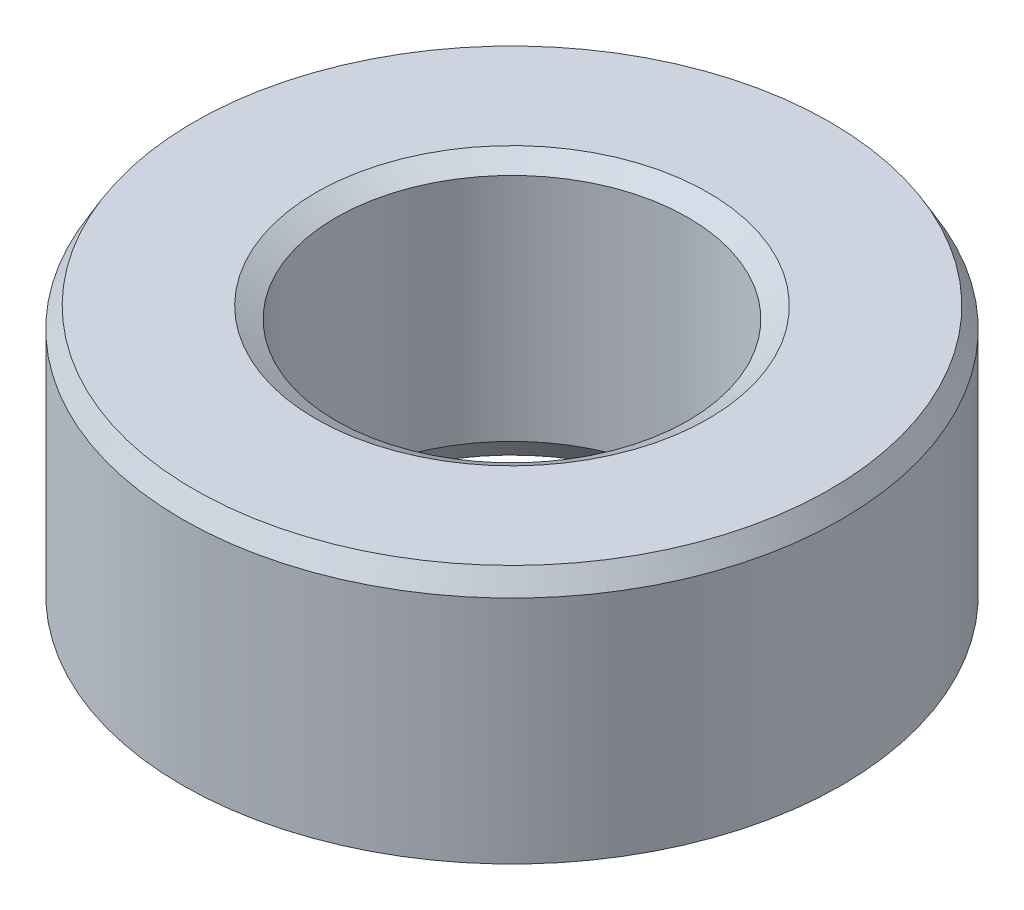
from build123d import *
from OCP.BRepFilletAPI import BRepFilletAPI_MakeChamfer

# Parameters (mm, degrees)
SKETCH1_R           = 42.5
BOSS_EXTRUDE1_DEPTH = 33.774315768
SKETCH2_R           = 22.689777708
CUT_EXTRUDE1_DEPTH  = 69.943487043
CHAMFER1_SIZE       = 2.59126219
CHAMFER1_SIZE2      = 1.496065923


with BuildPart() as part:
    # Sketch1 → Boss-Extrude1 (new body)
    with BuildSketch(Plane(origin=(0, 0, 0), x_dir=(1, 0, 0), z_dir=(0, 1, 0))):
        Circle(SKETCH1_R)
    extrude(amount=BOSS_EXTRUDE1_DEPTH)

    # Sketch2 → Cut-Extrude1 (cut, through all)
    with BuildSketch(Plane(origin=(0, 0, 0), x_dir=(1, 0, 0), z_dir=(0, 1, 0))):
        Circle(SKETCH2_R)
    extrude(amount=CUT_EXTRUDE1_DEPTH, mode=Mode.SUBTRACT)

    # Chamfer1: one chamfer whose edges measure the first distance from different faces: ONE call of the kernel's chamfer builder (chamfer() names one face for all edges)
    chamfer1_edges_1 = [part.edges().sort_by_distance(p)[0] for p in [
        (-22.689777708, 33.774315768, 0),
    ]]
    chamfer1_side_1 = [part.faces().sort_by_distance(p)[0] for p in [
        (-41.297918472, 33.774315768, 0),
    ]]
    chamfer1_edges_2 = [part.edges().sort_by_distance(p)[0] for p in [
        (-22.689777708, 0, 0),
    ]]
    chamfer1_side_2 = [part.faces().sort_by_distance(p)[0] for p in [
        (-22.689777708, 16.887157884, 0),
    ]]
    chamfer1_edges_3 = [part.edges().sort_by_distance(p)[0] for p in [
        (-42.5, 0, 0),
    ]]
    chamfer1_side_3 = [part.faces().sort_by_distance(p)[0] for p in [
        (-41.297918472, 0, 0),
    ]]
    chamfer1_edges_4 = [part.edges().sort_by_distance(p)[0] for p in [
        (-42.5, 33.774315768, 0),
    ]]
    chamfer1_side_4 = [part.faces().sort_by_distance(p)[0] for p in [
        (-42.5, 16.887157884, 0),
    ]]
    chamfer1 = BRepFilletAPI_MakeChamfer(part.part.solid().wrapped)
    for e in chamfer1_edges_1:
        chamfer1.Add(CHAMFER1_SIZE, CHAMFER1_SIZE2, e.wrapped, chamfer1_side_1[0].wrapped)  # the first distance lies on this face
    for e in chamfer1_edges_2:
        chamfer1.Add(CHAMFER1_SIZE, CHAMFER1_SIZE2, e.wrapped, chamfer1_side_2[0].wrapped)  # the first distance lies on this face
    for e in chamfer1_edges_3:
        chamfer1.Add(CHAMFER1_SIZE, CHAMFER1_SIZE2, e.wrapped, chamfer1_side_3[0].wrapped)  # the first distance lies on this face
    for e in chamfer1_edges_4:
        chamfer1.Add(CHAMFER1_SIZE, CHAMFER1_SIZE2, e.wrapped, chamfer1_side_4[0].wrapped)  # the first distance lies on this face
    add(Compound.cast(chamfer1.Shape()), mode=Mode.REPLACE)


solid = part.part
